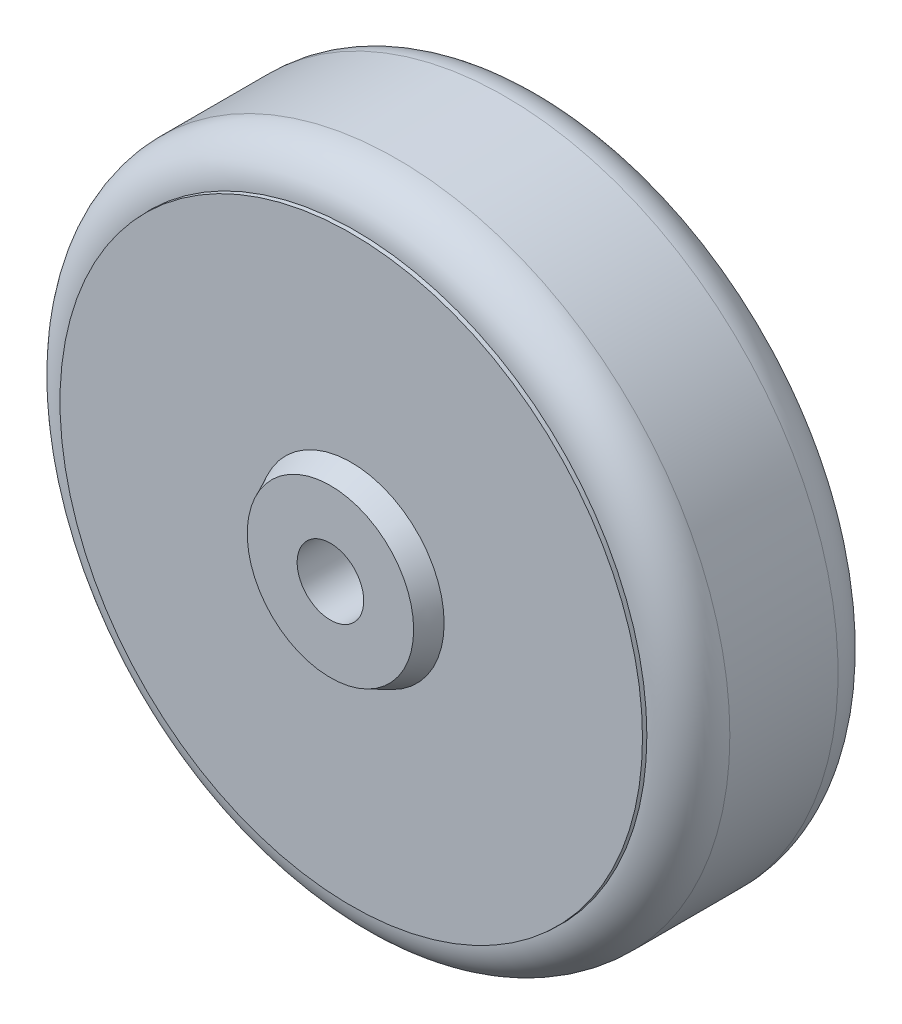
from build123d import *

# Parameters (mm, degrees)
SKETCH1_R           = 80
BOSS_EXTRUDE1_DEPTH = 62
SKETCH3_OUTSIDE_W   = 228.922
SKETCH3_OUTSIDE_H   = 228.922
SKETCH3_OUTSIDE_R   = 54
CUT_EXTRUDE1_DEPTH  = 10
CUT_EXTRUDE1_DRAFT  = -45
SKETCH4_OUTSIDE_W   = 213.586
SKETCH4_OUTSIDE_H   = 213.586
SKETCH4_OUTSIDE_R   = 20
CUT_EXTRUDE2_DEPTH  = 5
CUT_EXTRUDE2_DRAFT  = -25
CUT_EXTRUDE3_DEPTH  = 2
SKETCH6_OUTSIDE_W   = 209.028
SKETCH6_OUTSIDE_H   = 209.028
SKETCH6_OUTSIDE_R   = 70
CUT_EXTRUDE4_DEPTH  = 1
CUT_EXTRUDE4_DRAFT  = -3
SKETCH2_R           = 8
CUT_EXTRUDE5_DEPTH  = 50


with BuildPart() as part:
    # Sketch1 → Boss-Extrude1 (new body)
    with BuildSketch(Plane.XY):
        Circle(SKETCH1_R)
    extrude(amount=BOSS_EXTRUDE1_DEPTH)


with BuildPart() as cut_extrude1_tool:
    # Sketch3 outside → Cut-Extrude1 (with draft: the straight prism first)
    with BuildSketch(Plane(origin=(0, 0, 0), x_dir=(-1, 0, 0), z_dir=(0, 0, -1))):
        Rectangle(SKETCH3_OUTSIDE_W, SKETCH3_OUTSIDE_H)
        Circle(SKETCH3_OUTSIDE_R, mode=Mode.SUBTRACT)
    extrude(amount=-CUT_EXTRUDE1_DEPTH)
    # Cut-Extrude1: the draft: its side faces are tilted about the plane it starts from
    cut_extrude1_sides = [cut_extrude1_tool.faces().sort_by_distance(p)[0] for p in [
        (0, -114.461, 5),
        (-114.461, 0, 5),
        (0, 114.461, 5),
        (114.461, 0, 5),
        (54, 0, 5),
    ]]
    draft(cut_extrude1_sides, Plane(origin=(0, 0, 0), x_dir=(-1, 0, 0), z_dir=(0, 0, -1)), CUT_EXTRUDE1_DRAFT)


with BuildPart() as part_1:
    add(part.part)

    # Cut-Extrude1: cut by cut_extrude1_tool
    add(cut_extrude1_tool.part, mode=Mode.SUBTRACT)


with BuildPart() as cut_extrude2_tool:
    # Sketch4 outside → Cut-Extrude2 (with draft: the straight prism first)
    with BuildSketch(Plane.XY.offset(62)):
        Rectangle(SKETCH4_OUTSIDE_W, SKETCH4_OUTSIDE_H)
        Circle(SKETCH4_OUTSIDE_R, mode=Mode.SUBTRACT)
    extrude(amount=-CUT_EXTRUDE2_DEPTH)
    # Cut-Extrude2: the draft: its side faces are tilted about the plane it starts from
    cut_extrude2_sides = [cut_extrude2_tool.faces().sort_by_distance(p)[0] for p in [
        (0, -106.793, 59.5),
        (106.793, 0, 59.5),
        (0, 106.793, 59.5),
        (-106.793, 0, 59.5),
        (-20, 0, 59.5),
    ]]
    draft(cut_extrude2_sides, Plane.XY.offset(62), CUT_EXTRUDE2_DRAFT)


with BuildPart() as part_2:
    add(part_1.part)

    # Cut-Extrude2: cut by cut_extrude2_tool
    add(cut_extrude2_tool.part, mode=Mode.SUBTRACT)

    # Sketch5 → Cut-Extrude3 (cut)
    with BuildSketch(Plane(origin=(0, 0, 0), x_dir=(-1, 0, 0), z_dir=(0, 0, -1))):
        with BuildLine():
            Line((10.970305524, 10.229975401), (36.567685081, 34.099918003))
            ThreePointArc((36.567685081, 34.099918003), (47.552825815, 15.450849719), (49.627307582, -6.09346717))
            Line((49.627307582, -6.09346717), (14.888192275, -1.828040151))
            ThreePointArc((14.888192275, -1.828040151), (14.265847744, -4.635254916), (13.119295607, -7.272144304))
            Line((13.119295607, -7.272144304), (43.730985357, -24.240481012))
            ThreePointArc((43.730985357, -24.240481012), (29.389262615, -40.450849719), (9.540449769, -49.081359172))
            Line((9.540449769, -49.081359172), (2.862134931, -14.724407752))
            ThreePointArc((2.862134931, -14.724407752), (0, -15), (-2.862134931, -14.724407752))
            Line((-2.862134931, -14.724407752), (-9.540449769, -49.081359172))
            ThreePointArc((-9.540449769, -49.081359172), (-29.389262615, -40.450849719), (-43.730985357, -24.240481012))
            Line((-43.730985357, -24.240481012), (-13.119295607, -7.272144304))
            ThreePointArc((-13.119295607, -7.272144304), (-14.265847744, -4.635254916), (-14.888192275, -1.828040151))
            Line((-14.888192275, -1.828040151), (-49.627307582, -6.09346717))
            ThreePointArc((-49.627307582, -6.09346717), (-47.552825815, 15.450849719), (-36.567685081, 34.099918003))
            Line((-36.567685081, 34.099918003), (-10.970305524, 10.229975401))
            ThreePointArc((-10.970305524, 10.229975401), (-8.816778784, 12.135254916), (-6.339273926, 13.594616806))
            Line((-6.339273926, 13.594616806), (-21.130913087, 45.315389352))
            ThreePointArc((-21.130913087, 45.315389352), (0, 50), (21.130913087, 45.315389352))
            Line((21.130913087, 45.315389352), (6.339273926, 13.594616806))
            ThreePointArc((6.339273926, 13.594616806), (8.816778784, 12.135254916), (10.970305524, 10.229975401))
        make_face()
    extrude(amount=-CUT_EXTRUDE3_DEPTH, mode=Mode.SUBTRACT)


with BuildPart() as cut_extrude4_tool:
    # Sketch6 outside → Cut-Extrude4 (with draft: the straight prism first)
    with BuildSketch(Plane.XY.offset(57)):
        Rectangle(SKETCH6_OUTSIDE_W, SKETCH6_OUTSIDE_H)
        Circle(SKETCH6_OUTSIDE_R, mode=Mode.SUBTRACT)
    extrude(amount=-CUT_EXTRUDE4_DEPTH)
    # Cut-Extrude4: the draft: its side faces are tilted about the plane it starts from
    cut_extrude4_sides = [cut_extrude4_tool.faces().sort_by_distance(p)[0] for p in [
        (0, -104.514, 56.5),
        (104.514, 0, 56.5),
        (0, 104.514, 56.5),
        (-104.514, 0, 56.5),
        (-70, 0, 56.5),
    ]]
    draft(cut_extrude4_sides, Plane.XY.offset(57), CUT_EXTRUDE4_DRAFT)


with BuildPart() as part_3:
    add(part_2.part)

    # Cut-Extrude4: cut by cut_extrude4_tool
    add(cut_extrude4_tool.part, mode=Mode.SUBTRACT)

    # Fillet1: read off the stored shape, not the designer's step
    # Fillet1 outline → Fillet1 (revolve, cut)
    with BuildSketch(Plane.XZ):
        with BuildLine():
            ThreePointArc((80, 20), (77.071067812, 12.928932188), (70, 10))
            Line((70, 10), (80, 10))
            Line((80, 10), (80, 20))
        make_face()
        with BuildLine():
            ThreePointArc((70.052407779, 56), (77.089572547, 53.052651853), (80, 46.00013733))
            Line((80, 46.00013733), (80, 56))
            Line((80, 56), (70.052407779, 56))
        make_face()
    revolve(axis=Axis((0, 0, 0), (0, 0, 1)), mode=Mode.SUBTRACT)

    # Fillet1 2 outline → Fillet1 2 (revolve)
    with BuildSketch(Plane.XZ):
        with BuildLine():
            Line((61.071067812, 10), (61.071067812, 7.071067812))
            ThreePointArc((61.071067812, 7.071067812), (64.3153013, 9.238795325), (68.142135624, 10))
            Line((68.142135624, 10), (61.071067812, 10))
        make_face()
    revolve(axis=Axis((0, 0, 0), (0, 0, 1)))

    # Sketch2 → Cut-Extrude5 (cut)
    with BuildSketch(Plane.XY.offset(62)):
        Circle(SKETCH2_R)
    extrude(amount=-CUT_EXTRUDE5_DEPTH, mode=Mode.SUBTRACT)


solid = part_3.part
